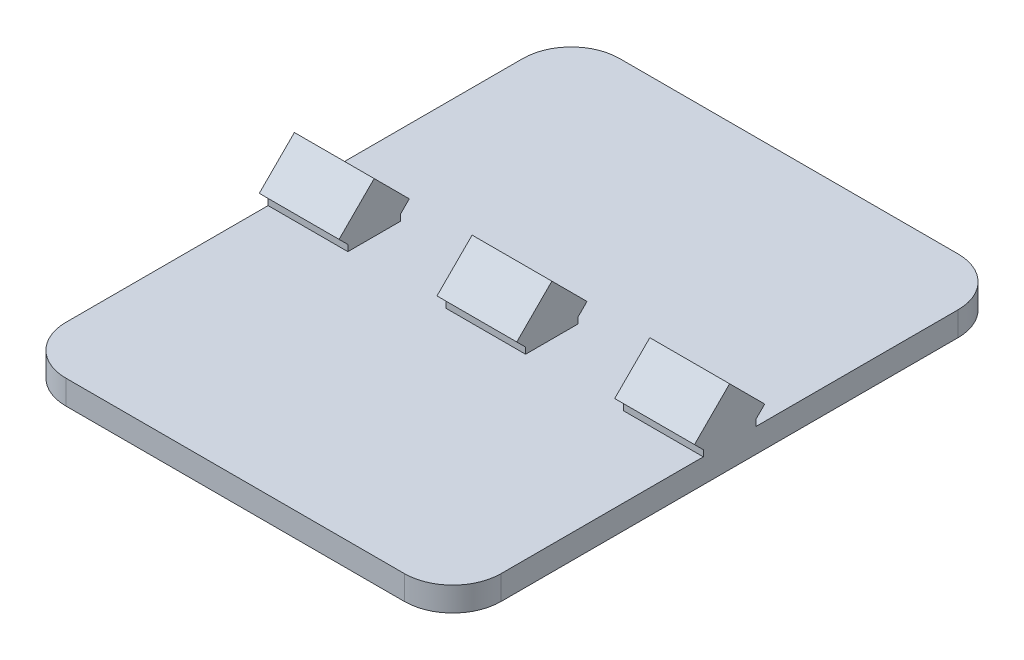
from build123d import *

# Parameters (mm, degrees)
SKETCH1_W           = 18
SKETCH1_H           = 22.9
BOSS_EXTRUDE1_DEPTH = 1
BOSS_EXTRUDE2_DEPTH = 18
SKETCH3_W           = 4.05
SKETCH3_H           = 4.220941173
SKETCH3_H_2         = 4.757824116
CUT_EXTRUDE1_DEPTH  = 18
CUT_EXTRUDE2_START  = -0.2
CUT_EXTRUDE2_DEPTH  = 0.2
FILLET1_R           = 2


# Read off the part's stored shape, not the designer's step: Cut-Extrude2
with BuildPart() as part:
    # Sketch1 → Boss-Extrude1 (new body)
    with BuildSketch(Plane(origin=(0, 0, 0), x_dir=(1, 0, 0), z_dir=(0, 1, 0))):
        with Locations((-18.831189637, 14.663631275)):
            Rectangle(SKETCH1_W, SKETCH1_H)
    extrude(amount=BOSS_EXTRUDE1_DEPTH)

    # Sketch2 → Boss-Extrude2 (add)
    with BuildSketch(Plane(origin=(-9.831189637, 0, 0), x_dir=(0, 0, -1), z_dir=(1, 0, 0))):
        Polygon((14.663631275, 3.074615702), (13.575748223, 1.98673265), (15.751514327, 1.98673265), align=None)
        Polygon((13.211216123, 1.62220055), (13.575748223, 1.25766845), (13.575748223, 1.98673265), align=None)
        Polygon((13.575748223, 1.25766845), (13.833416673, 1), (15.493845876, 1), (15.751514327, 1.25766845), (15.751514327, 1.98673265), (13.575748223, 1.98673265), align=None)
        Polygon((13.575748223, 1), (13.833416673, 1), (13.575748223, 1.25766845), align=None)
        Polygon((15.751514327, 1.98673265), (15.751514327, 1.25766845), (16.116046427, 1.62220055), align=None)
        Polygon((15.751514327, 1.25766845), (15.493845876, 1), (15.751514327, 1), align=None)
    extrude(amount=-BOSS_EXTRUDE2_DEPTH)

    # Sketch3 → Cut-Extrude1 (cut)
    with BuildSketch(Plane.XY.offset(-3.213631275)):
        with Locations((-22.506363414, 3.110470586)):
            Rectangle(SKETCH3_W, SKETCH3_H)
        with Locations((-15.156363414, 3.378912058)):
            Rectangle(SKETCH3_W, SKETCH3_H_2)
    extrude(amount=-CUT_EXTRUDE1_DEPTH, mode=Mode.SUBTRACT)

    # Cut-Extrude2 outline → Cut-Extrude2 (cut)
    with BuildSketch(Plane.XZ.offset(CUT_EXTRUDE2_START)):
        with BuildLine():
            add(Edge.make_bspline(
                [(-17.230590899, -17.962499081), (-17.07397106, -18.016498859), (-16.771174279, -18.120897889), (-16.33094545, -18.269090985), (-15.9244925, -18.415385659), (-15.545846333, -18.547321486), (-15.199557598, -18.674234494), (-14.883696795, -18.794118608), (-14.598374675, -18.903900488), (-14.342915925, -19.005407449), (-14.119003777, -19.100311486), (-13.928301347, -19.192843199), (-13.771684802, -19.284276496), (-13.644334003, -19.368657153), (-13.555198096, -19.458235622), (-13.494275109, -19.541448732), (-13.461814796, -19.628277497), (-13.475027787, -19.68318659), (-13.48139996, -19.709667365)],
                knots=[0, 0, 0, 0, 0.116708039, 0.225634369, 0.327215414, 0.421013695, 0.508104613, 0.587021253, 0.659014378, 0.723470128, 0.780659849, 0.830322445, 0.872634494, 0.908424717, 0.937576617, 0.961001425, 0.981192323, 1, 1, 1, 1], degree=3))
            Line((-17.230590899, -17.962499081), (-17.593050446, -17.846398757))
            add(Edge.make_bspline(
                [(-21.075758595, -16.851205174), (-20.50215298, -16.995746331), (-19.331047474, -17.29169904), (-18.180281706, -17.65897783), (-17.593050446, -17.846398757)],
                knots=[0.011239766, 0.011239766, 0.011239766, 0.011239766, 0.495439529, 1, 1, 1, 1], degree=3))
            add(Edge.make_bspline(
                [(-19.4648142, -16.269133385), (-19.638291005, -16.335779972), (-20.001865046, -16.47545841), (-20.414134803, -16.624192081), (-20.693227489, -16.719503302), (-20.811191708, -16.76257507), (-20.910575715, -16.796542001), (-20.986313292, -16.821426192), (-21.046198882, -16.841915837), (-21.066329028, -16.8479747), (-21.075758595, -16.851205174)],
                knots=[0, 0, 0, 0, 0.318623786, 0.667774212, 0.751717284, 0.823898819, 0.88378277, 0.929845664, 0.965672361, 0.980758347, 0.980758347, 0.980758347, 0.980758347], degree=3))
            add(Edge.make_bspline(
                [(-11.819183132, -11.084262835), (-11.856777908, -11.18474996), (-11.931823114, -11.385338387), (-12.064139438, -11.678296053), (-12.222026211, -11.958260063), (-12.394176828, -12.230109253), (-12.583894413, -12.493122188), (-12.798287589, -12.740893621), (-13.02761338, -12.983244062), (-13.362041273, -13.292459196), (-13.81598101, -13.658848413), (-14.406177559, -14.062701459), (-15.043929226, -14.438104087), (-15.612949314, -14.723173281), (-16.100482848, -14.942810542), (-16.496931285, -15.115631424), (-16.921835832, -15.293771738), (-17.3749271, -15.477877257), (-17.85777735, -15.66728409), (-18.367697143, -15.865575578), (-18.907134482, -16.066418031), (-19.275942137, -16.200478804), (-19.4648142, -16.269133385)],
                knots=[0, 0, 0, 0, 0.033701009, 0.067272621, 0.100854709, 0.134581797, 0.168329736, 0.202615319, 0.237431506, 0.273098484, 0.345620648, 0.42046794, 0.497564574, 0.577926818, 0.620259406, 0.665542454, 0.713785068, 0.764994776, 0.819177867, 0.87672292, 0.936867914, 1, 1, 1, 1], degree=3))
            add(Edge.make_bspline(
                [(-16.771853035, -7.694699728), (-16.615142115, -7.695515237), (-16.309137129, -7.697107657), (-15.860523427, -7.717441549), (-15.432590193, -7.750710782), (-15.026568589, -7.799086818), (-14.641791438, -7.857735915), (-14.278898696, -7.931379999), (-13.936397409, -8.018134905), (-13.616293051, -8.120541116), (-13.318937617, -8.232784084), (-13.046036094, -8.356972174), (-12.798417355, -8.493856474), (-12.573873718, -8.639001058), (-12.377798104, -8.799940968), (-12.202296942, -8.967505875), (-12.051126902, -9.147796484), (-11.930871052, -9.342308566), (-11.828872714, -9.541101326), (-11.757047201, -9.748426296), (-11.704145565, -9.958628304), (-11.6796241, -10.174560518), (-11.675885012, -10.395804206), (-11.700298585, -10.622331169), (-11.744496025, -10.854287558), (-11.793886832, -11.006370896), (-11.819183132, -11.084262835)],
                knots=[0, 0, 0, 0, 0.065991068, 0.128858894, 0.1890718, 0.246710417, 0.301019339, 0.352939384, 0.402591263, 0.449734068, 0.494398442, 0.53637646, 0.575874007, 0.613469494, 0.648794043, 0.682528375, 0.715559806, 0.747541271, 0.77865117, 0.809454811, 0.839728096, 0.869755061, 0.90076321, 0.932722434, 0.965542708, 1, 1, 1, 1], degree=3))
            add(Edge.make_bspline(
                [(-21.339409669, -8.122288725), (-21.182872007, -8.093102242), (-20.853623002, -8.03171369), (-20.332349866, -7.953264989), (-19.759015334, -7.883378793), (-19.147138691, -7.820648986), (-18.523393293, -7.763531354), (-17.914382284, -7.723868895), (-17.333658705, -7.700667574), (-16.955933456, -7.696655144), (-16.771853035, -7.694699728)],
                knots=[0, 0, 0, 0, 0.103996574, 0.218738213, 0.344221052, 0.481203105, 0.620462215, 0.753290129, 0.879768543, 1, 1, 1, 1], degree=3))
            add(Edge.make_bspline(
                [(-26.006076336, -9.931754744), (-25.987138992, -9.890034091), (-25.946214342, -9.799873446), (-25.836729944, -9.677643386), (-25.691496084, -9.554197678), (-25.506100531, -9.429962832), (-25.279057225, -9.309153932), (-25.012820726, -9.185951761), (-24.707719526, -9.057672122), (-24.243475977, -8.894454832), (-23.63220339, -8.695117133), (-22.879645022, -8.477335106), (-22.114864252, -8.283360039), (-21.598464156, -8.176097481), (-21.339409669, -8.122288725)],
                knots=[0, 0, 0, 0, 0.026822347, 0.057964579, 0.095369075, 0.138956881, 0.188904372, 0.246539542, 0.311511398, 0.383531281, 0.535960952, 0.689739098, 0.844356189, 1, 1, 1, 1], degree=3))
            add(Edge.make_bspline(
                [(-25.677597371, -10.611366395), (-25.715938218, -10.610220814), (-25.788468551, -10.608053689), (-25.884522776, -10.563975755), (-25.967715107, -10.50447129), (-26.018552279, -10.411926706), (-26.054034149, -10.307409975), (-26.060335117, -10.189045195), (-26.045835527, -10.061764973), (-26.019831532, -9.97673343), (-26.006076336, -9.931754744)],
                knots=[0, 0, 0, 0, 0.125376478, 0.237177804, 0.343859109, 0.457258603, 0.578573701, 0.706788672, 0.844901554, 1, 1, 1, 1], degree=3))
            add(Edge.make_bspline(
                [(-24.745963067, -10.339521734), (-24.805078311, -10.369550162), (-24.938612744, -10.437380873), (-25.159938287, -10.526743587), (-25.412044891, -10.598709213), (-25.589322036, -10.607158876), (-25.677597371, -10.611366395)],
                knots=[0, 0, 0, 0, 0.202895202, 0.458316572, 0.730268185, 1, 1, 1, 1], degree=3))
            add(Edge.make_bspline(
                [(-21.35639996, -9.226657657), (-21.553849987, -9.271224256), (-21.925935055, -9.355207867), (-22.447562573, -9.484653836), (-22.898664496, -9.61029743), (-23.412111616, -9.780055842), (-24.024165703, -10.013932122), (-24.499735784, -10.228453103), (-24.745963067, -10.339521734)],
                knots=[0, 0, 0, 0, 0.169784043, 0.319949855, 0.450783012, 0.562450822, 0.77345811, 1, 1, 1, 1], degree=3))
            add(Edge.make_bspline(
                [(-19.922482981, -8.998858245), (-19.92667027, -9.000495621), (-19.944499846, -9.006349387), (-19.992715259, -9.011797086), (-20.062441984, -9.028117506), (-20.157829733, -9.04046203), (-20.273644567, -9.057989246), (-20.452870988, -9.084033608), (-20.678409881, -9.109545005), (-20.930707045, -9.152056949), (-21.154033001, -9.186611194), (-21.292287674, -9.213970456), (-21.35639996, -9.226657657)],
                knots=[0.029697031, 0.029697031, 0.029697031, 0.029697031, 0.039132727, 0.07176661, 0.121818402, 0.184914604, 0.263247786, 0.356819301, 0.54745303, 0.717770185, 0.869122698, 1, 1, 1, 1], degree=3))
            add(Edge.make_bspline(
                [(-20.523875688, -10.622693255), (-20.453202019, -10.425380047), (-20.31737441, -10.046164116), (-20.152653107, -9.591202709), (-20.03037511, -9.283950465), (-19.972035882, -9.123278076), (-19.937512534, -9.036449356), (-19.923783693, -9.002110499), (-19.922482981, -8.998858245)],
                knots=[0, 0, 0, 0, 0.358955217, 0.689875438, 0.828569795, 0.925252737, 0.982589174, 0.988587997, 0.988587997, 0.988587997, 0.988587997], degree=3))
            add(Edge.make_bspline(
                [(-22.276707404, -16.017110731), (-22.215211974, -15.826487269), (-22.095610607, -15.455747088), (-21.923547427, -14.914371967), (-21.759254479, -14.404677187), (-21.603668596, -13.927316801), (-21.458033745, -13.481240699), (-21.325970431, -13.065289639), (-21.202164825, -12.680855816), (-21.084275034, -12.328730994), (-20.980610223, -12.007439004), (-20.886782732, -11.716533838), (-20.802005781, -11.458154313), (-20.728688405, -11.230262865), (-20.663056263, -11.034091909), (-20.607119612, -10.868991517), (-20.561179626, -10.73517032), (-20.535151347, -10.656691088), (-20.523875688, -10.622693255)],
                knots=[0, 0, 0, 0, 0.105937844, 0.20603663, 0.30044881, 0.389175095, 0.471586674, 0.548634009, 0.619994926, 0.685196234, 0.745031578, 0.798552266, 0.846862115, 0.888857242, 0.925167791, 0.956268966, 0.981055366, 1, 1, 1, 1], degree=3))
            add(Edge.make_bspline(
                [(-22.749603844, -16.501334032), (-22.722643128, -16.437202506), (-22.670836595, -16.313970166), (-22.530423164, -16.18175832), (-22.397968421, -16.088656393), (-22.312843682, -16.038431631), (-22.276707404, -16.017110731)],
                knots=[0, 0, 0, 0, 0.297891181, 0.572414689, 0.81848588, 1, 1, 1, 1], degree=3))
            add(Edge.make_bspline(
                [(-22.854377307, -17.220589696), (-22.85135012, -17.153517203), (-22.845281414, -17.01905465), (-22.823295424, -16.824146286), (-22.792469091, -16.650723897), (-22.762556435, -16.546475165), (-22.749603844, -16.501334032)],
                knots=[0, 0, 0, 0, 0.276265787, 0.553839605, 0.806806422, 1, 1, 1, 1], degree=3))
            add(Edge.make_bspline(
                [(-22.69863297, -17.577385812), (-22.705226934, -17.569826745), (-22.730326465, -17.541053609), (-22.783540536, -17.482136557), (-22.837389178, -17.368724713), (-22.848228014, -17.274210992), (-22.854377307, -17.220589696)],
                knots=[0, 0, 0, 0, 0.075535271, 0.287520488, 0.595782764, 1, 1, 1, 1], degree=3))
            add(Edge.make_bspline(
                [(-23.120558536, -18.956431119), (-23.080678596, -18.823410173), (-23.002372184, -18.562216374), (-22.894191713, -18.187194281), (-22.792955031, -17.860611321), (-22.727210295, -17.663196357), (-22.69863297, -17.577385812)],
                knots=[0, 0, 0, 0, 0.288860599, 0.567193358, 0.811871537, 1, 1, 1, 1], degree=3))
            add(Edge.make_bspline(
                [(-23.576464685, -20.496884194), (-23.564962759, -20.462959919), (-23.539176379, -20.386904466), (-23.5006269, -20.258824165), (-23.45158845, -20.106488541), (-23.397653116, -19.927161196), (-23.339476522, -19.720740536), (-23.270538838, -19.489096161), (-23.197279352, -19.231298512), (-23.146910736, -19.05084305), (-23.120558536, -18.956431119)],
                knots=[0, 0, 0, 0, 0.066881889, 0.149943731, 0.249723225, 0.365700054, 0.499579896, 0.650167322, 0.816972132, 1, 1, 1, 1], degree=3))
            add(Edge.make_bspline(
                [(-23.907775365, -21.725848595), (-23.90485588, -21.715487435), (-23.895909559, -21.683737218), (-23.882640448, -21.617401413), (-23.863169788, -21.517298941), (-23.837938253, -21.381889466), (-23.801857965, -21.211027853), (-23.744172042, -21.005250369), (-23.665886791, -20.763472256), (-23.607789957, -20.590272104), (-23.576464685, -20.496884194)],
                knots=[0, 0, 0, 0, 0.025332174, 0.077626632, 0.159108677, 0.265429548, 0.401829385, 0.569996159, 0.768145931, 1, 1, 1, 1], degree=3))
            add(Edge.make_bspline(
                [(-23.556642679, -22.292191637), (-23.590939094, -22.29119966), (-23.655257776, -22.28933933), (-23.741721455, -22.259181385), (-23.815033324, -22.216831917), (-23.866418213, -22.150105819), (-23.904601066, -22.068250758), (-23.922263275, -21.968307535), (-23.924774251, -21.851892239), (-23.913747109, -21.770127992), (-23.907775365, -21.725848595)],
                knots=[0, 0, 0, 0, 0.129797545, 0.243419229, 0.34510905, 0.447242242, 0.558161683, 0.686408305, 0.830174537, 1, 1, 1, 1], degree=3))
            add(Edge.make_bspline(
                [(-22.305024556, -21.612579987), (-22.32386893, -21.655258862), (-22.363656212, -21.745369388), (-22.469021342, -21.865674586), (-22.610832441, -21.977731679), (-22.780938299, -22.083970757), (-22.968228465, -22.176205769), (-23.163527465, -22.241778344), (-23.359513319, -22.283233903), (-23.491318475, -22.289223247), (-23.556642679, -22.292191637)],
                knots=[0, 0, 0, 0, 0.093289549, 0.196967946, 0.316920524, 0.45582306, 0.599159768, 0.73529025, 0.868806699, 1, 1, 1, 1], degree=3))
            add(Edge.make_bspline(
                [(-22.098309345, -20.281673838), (-22.122987174, -20.364458785), (-22.169784947, -20.521447925), (-22.21971603, -20.748762504), (-22.256872824, -20.953519883), (-22.268816036, -21.136706669), (-22.273534782, -21.294494759), (-22.277731588, -21.425903867), (-22.287681378, -21.529211357), (-22.299932029, -21.588100217), (-22.305024556, -21.612579987)],
                knots=[0, 0, 0, 0, 0.191610492, 0.363360338, 0.516245244, 0.65279061, 0.770157968, 0.866596465, 0.944544898, 1, 1, 1, 1], degree=3))
            Line((-22.098309345, -20.281673838), (-21.432856271, -17.987984518))
            add(Edge.make_bspline(
                [(-18.326464685, -19.055541152), (-18.458378404, -19.006747402), (-18.734195207, -18.904725138), (-19.170756525, -18.758454095), (-19.647006858, -18.608902968), (-20.063064085, -18.483856689), (-20.395912734, -18.384825092), (-20.623793676, -18.31424978), (-20.823855483, -18.24688807), (-20.996712547, -18.183209946), (-21.145213551, -18.130805998), (-21.266798035, -18.08100312), (-21.360045102, -18.033551317), (-21.41130593, -18.001471186), (-21.432856271, -17.987984518)],
                knots=[0, 0, 0, 0, 0.128290252, 0.26824054, 0.41991738, 0.583619963, 0.664522688, 0.736688343, 0.801218036, 0.857050962, 0.90471849, 0.944854783, 0.976816639, 1, 1, 1, 1], degree=3))
            add(Edge.make_bspline(
                [(-15.664652387, -20.426091314), (-15.747186557, -20.366798378), (-15.917985342, -20.244095727), (-16.192398403, -20.069808535), (-16.49087826, -19.897737534), (-16.810843062, -19.72365846), (-17.156982678, -19.555629567), (-17.524471691, -19.385013125), (-17.916772134, -19.217917412), (-18.187468354, -19.110630522), (-18.326464685, -19.055541152)],
                knots=[0, 0, 0, 0, 0.101532151, 0.210113803, 0.324648339, 0.445766614, 0.573998882, 0.709043188, 0.850600317, 1, 1, 1, 1], degree=3))
            add(Edge.make_bspline(
                [(-14.806642679, -20.774392285), (-14.878721137, -20.77070081), (-15.013848687, -20.763780296), (-15.178260907, -20.716697553), (-15.300139346, -20.65217372), (-15.40816693, -20.59398754), (-15.530487346, -20.515086255), (-15.617536089, -20.457344703), (-15.664652387, -20.426091314)],
                knots=[0, 0, 0, 0, 0.229222892, 0.429730723, 0.537182848, 0.667579277, 0.820072829, 1, 1, 1, 1], degree=3))
            add(Edge.make_bspline(
                [(-13.48139996, -19.709667365), (-13.500073514, -19.752752929), (-13.542945267, -19.851671093), (-13.645529679, -20.00172695), (-13.784103877, -20.175394426), (-13.949270194, -20.364490792), (-14.137351396, -20.544149509), (-14.350374671, -20.674961081), (-14.573798503, -20.760297914), (-14.729461983, -20.769720433), (-14.806642679, -20.774392285)],
                knots=[0, 0, 0, 0, 0.078809258, 0.180934551, 0.304119948, 0.452520589, 0.603044477, 0.739139585, 0.87066081, 1, 1, 1, 1], degree=3))
        make_face()
        with BuildLine():
            add(Edge.make_bspline(
                [(-19.4648142, -15.161932738), (-19.241548072, -15.083056891), (-18.807207281, -14.92961222), (-18.181235463, -14.683026203), (-17.591854708, -14.444356155), (-17.042109541, -14.20393411), (-16.532821291, -13.962851975), (-16.06006968, -13.725886767), (-15.628929891, -13.485881709), (-15.233629563, -13.247104982), (-14.87622088, -13.004524598), (-14.553858583, -12.753661625), (-14.263857095, -12.496809879), (-14.008480525, -12.230382983), (-13.785770939, -11.956779661), (-13.594258759, -11.677038453), (-13.439407368, -11.385854047), (-13.361463857, -11.184221003), (-13.322823909, -11.084262835)],
                knots=[0, 0, 0, 0, 0.09356629, 0.182023386, 0.265838046, 0.344843319, 0.419094992, 0.488491074, 0.553777585, 0.614039351, 0.670942783, 0.724366757, 0.775354778, 0.823897824, 0.870036733, 0.914626758, 0.957676814, 1, 1, 1, 1], degree=3))
            add(Edge.make_bspline(
                [(-20.729056131, -15.580803626), (-20.723005993, -15.577955371), (-20.690963793, -15.563335601), (-20.625367528, -15.542187248), (-20.524175203, -15.510035952), (-20.27932013, -15.439290402), (-19.920945003, -15.329071008), (-19.609758447, -15.215044105), (-19.4648142, -15.161932738)],
                knots=[0.101710574, 0.101710574, 0.101710574, 0.101710574, 0.115073812, 0.171853588, 0.241916804, 0.329534856, 0.687711233, 1, 1, 1, 1], degree=3))
            Line((-20.729056131, -15.580803626), (-20.059474394, -13.443081605))
            Line((-20.059474394, -13.443081605), (-19.130671805, -10.55473209))
            add(Edge.make_bspline(
                [(-18.496367598, -8.886851831), (-18.501168103, -8.897200581), (-18.5200599, -8.937926811), (-18.554157024, -9.033293585), (-18.622453809, -9.186955773), (-18.704876524, -9.398488493), (-18.806930623, -9.649959662), (-18.908886404, -9.932693324), (-19.021182965, -10.235623005), (-19.093371667, -10.446019521), (-19.130671805, -10.55473209)],
                knots=[0, 0, 0, 0, 0.019170178, 0.075441877, 0.170023863, 0.301715841, 0.456977584, 0.626142714, 0.806826716, 1, 1, 1, 1], degree=3))
            add(Edge.make_bspline(
                [(-17.338196077, -8.884020116), (-17.429755009, -8.884011107), (-17.599658183, -8.883994388), (-17.836576693, -8.884100859), (-18.036689517, -8.88378401), (-18.199971461, -8.884656729), (-18.326503818, -8.88245893), (-18.415168365, -8.887405674), (-18.468050889, -8.886823486), (-18.490704256, -8.886846162), (-18.496367598, -8.886851831)],
                knots=[0, 0, 0, 0, 0.237154756, 0.440080991, 0.613668493, 0.755472368, 0.863047722, 0.941322535, 0.985330634, 1, 1, 1, 1], degree=3))
            add(Edge.make_bspline(
                [(-13.322823909, -11.084262835), (-13.297176808, -10.994416402), (-13.247045924, -10.818798844), (-13.255714013, -10.543964864), (-13.329281638, -10.278120286), (-13.472300438, -10.021081422), (-13.691427054, -9.780722964), (-13.987611487, -9.56121825), (-14.363843809, -9.369068041), (-14.728393872, -9.230938991), (-15.057011447, -9.132868293), (-15.328879539, -9.064563183), (-15.61905838, -9.007908393), (-15.928291433, -8.963853171), (-16.254932484, -8.926683031), (-16.599718231, -8.901371002), (-16.962411294, -8.887845214), (-17.210758146, -8.885317302), (-17.338196077, -8.884020116)],
                knots=[0, 0, 0, 0, 0.053080688, 0.10375371, 0.154615544, 0.209371656, 0.270063093, 0.338941589, 0.41873936, 0.510522867, 0.561164352, 0.614496168, 0.670516149, 0.729891522, 0.792801413, 0.858194837, 0.927233398, 1, 1, 1, 1], degree=3))
        make_face(mode=Mode.SUBTRACT)
    extrude(amount=CUT_EXTRUDE2_DEPTH, mode=Mode.SUBTRACT)

    # Fillet1
    fillet1_edges = [part.edges().sort_by_distance(p)[0] for p in [
        (-27.831189637, 0.5, -26.113631275),
        (-9.831189637, 0.5, -26.113631275),
        (-9.831189637, 0.5, -3.213631275),
        (-27.831189637, 0.5, -3.213631275),
    ]]
    fillet(fillet1_edges, radius=FILLET1_R)


solid = part.part
